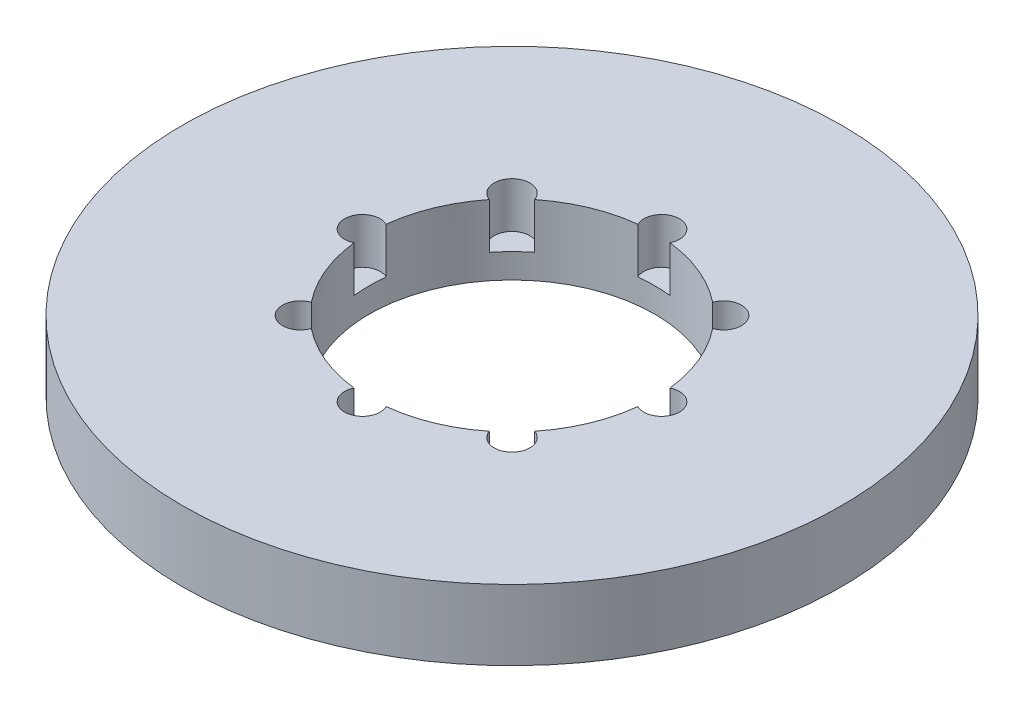
from build123d import *

# Parameters (mm, degrees)
SKETCH1_R           = 75
BOSS_EXTRUDE1_DEPTH = 16
SKETCH2_R           = 32.5
CUT_EXTRUDE1_DEPTH  = 108.266024444
SKETCH3_R           = 4.05931394
CUT_EXTRUDE2_DEPTH  = 10.401572884
CIRPATTERN1_COUNT   = 8


with BuildPart() as part:
    # Sketch1 → Boss-Extrude1 (new body)
    with BuildSketch(Plane(origin=(0, 0, 0), x_dir=(1, 0, 0), z_dir=(0, 1, 0))):
        Circle(SKETCH1_R)
    extrude(amount=BOSS_EXTRUDE1_DEPTH)

    # Sketch2 → Cut-Extrude1 (cut, through all)
    with BuildSketch(Plane(origin=(0, 0, 0), x_dir=(1, 0, 0), z_dir=(0, 1, 0))):
        Circle(SKETCH2_R)
    extrude(amount=CUT_EXTRUDE1_DEPTH, mode=Mode.SUBTRACT)

    # Sketch3 → Cut-Extrude2 (cut)
    with BuildSketch(Plane(origin=(0, 16, 0), x_dir=(1, 0, 0), z_dir=(0, 1, 0))):
        with Locations((-34.053890811, 0)):
            Circle(SKETCH3_R)
    cut_extrude2 = extrude(amount=-CUT_EXTRUDE2_DEPTH, mode=Mode.SUBTRACT)

    # CirPattern1: Cut-Extrude2 ×8 about axis
    cirpattern1_axis = Axis((0, 0, 0), (0, 1, 0))
    for i in range(1, CIRPATTERN1_COUNT):
        add(cut_extrude2.rotate(cirpattern1_axis, i * 360 / CIRPATTERN1_COUNT), mode=Mode.SUBTRACT)


solid = part.part
